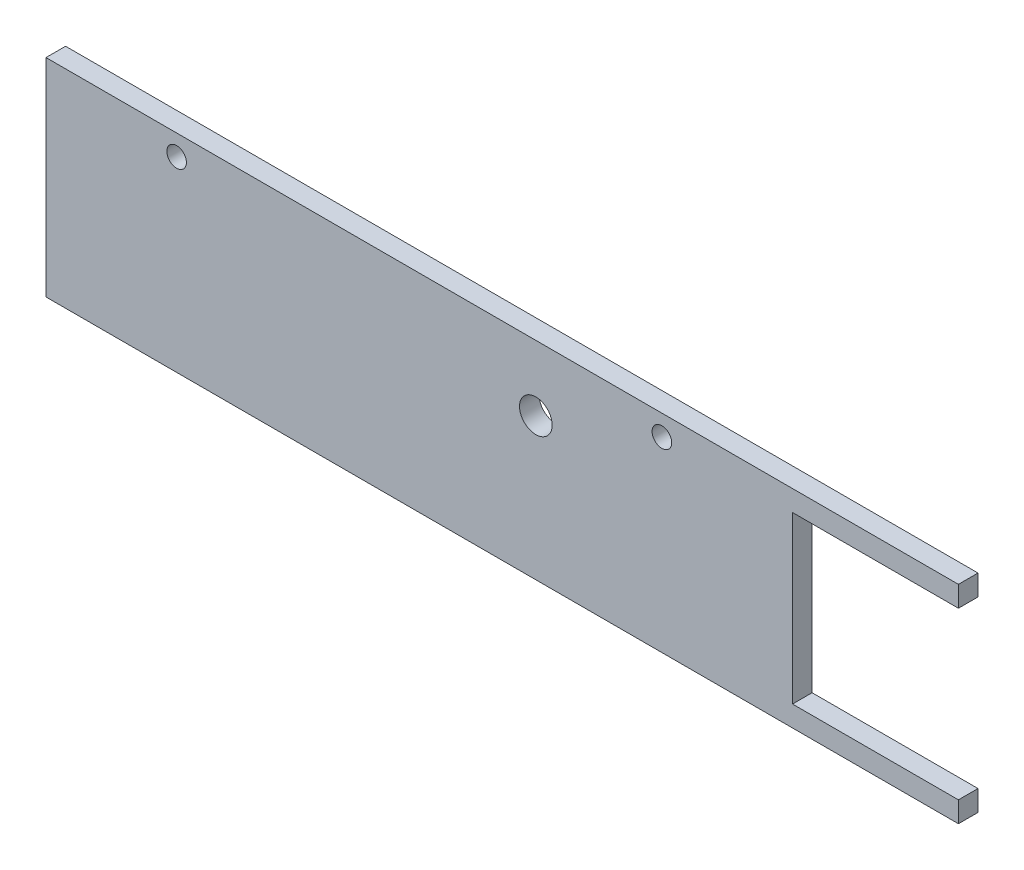
from build123d import *

# Parameters (mm, degrees)
SKETCH2_W                 = 139.7
SKETCH2_H                 = 31.75
BOSS_EXTRUDE1_DEPTH       = 3
SKETCH3_W                 = 25.4
SKETCH3_H                 = 25.4
CUT_EXTRUDE1_DEPTH        = 144.293937415
CUT_EXTRUDE4_DEPTH        = 144.293937415
CUT_EXTRUDE4_DEPTH_BACK   = 6.35
SKETCH9_R                 = 1.5
CUT_EXTRUDE5_DEPTH        = 144.293937415
CUT_EXTRUDE5_DEPTH_BACK   = 144.293937415
SKETCH8_R                 = 2.5
F_3_0MM_DOWEL_HOLE2_D     = 3
F_3_0MM_DOWEL_HOLE2_DEPTH = 6.35
F_3_0MM_DOWEL_HOLE2_TIP   = 0.901290929


with BuildPart() as part:
    # Sketch2 → Boss-Extrude1 (new body)
    with BuildSketch(Plane.XY):
        with Locations((-69.85, -15.875)):
            Rectangle(SKETCH2_W, SKETCH2_H)
    extrude(amount=BOSS_EXTRUDE1_DEPTH)

    # Sketch3 → Cut-Extrude1 (cut, through all)
    with BuildSketch(Plane.XY.offset(3)):
        with Locations((-12.7, -15.875)):
            Rectangle(SKETCH3_W, SKETCH3_H)
    extrude(amount=-CUT_EXTRUDE1_DEPTH, mode=Mode.SUBTRACT)

    # Sketch9 → Cut-Extrude4 (cut, two sides: drawn at the far end of the back side and taken through both)
    with BuildSketch(Plane.XY.offset(3).offset(-CUT_EXTRUDE4_DEPTH_BACK)):
        with Locations((-119.7, -3.175)):
            Circle(SKETCH9_R)
        with Locations((-45.4, -3.175)):
            Circle(SKETCH9_R)
    extrude(amount=CUT_EXTRUDE4_DEPTH + CUT_EXTRUDE4_DEPTH_BACK, mode=Mode.SUBTRACT)

    # Sketch8 → Cut-Extrude5 (cut, two sides: drawn at the far end of the back side and taken through both)
    with BuildSketch(Plane.XY.offset(3).offset(-CUT_EXTRUDE5_DEPTH_BACK)):
        with Locations((-64.7, -10)):
            Circle(SKETCH8_R)
    extrude(amount=CUT_EXTRUDE5_DEPTH + CUT_EXTRUDE5_DEPTH_BACK, mode=Mode.SUBTRACT)

    # Ø3.0mm Dowel Hole2
    with Locations(Plane(origin=(-146.05, -31.75, 0), x_dir=(1, 0, 0), z_dir=(0, 0, 1))):
        with Locations((26.35, 28.575), (100.65, 28.575)):
            Hole(F_3_0MM_DOWEL_HOLE2_D / 2, depth=F_3_0MM_DOWEL_HOLE2_DEPTH)
            with Locations((0, 0, -(F_3_0MM_DOWEL_HOLE2_DEPTH + F_3_0MM_DOWEL_HOLE2_TIP / 2))):  # 118° drill point
                Cone(0, F_3_0MM_DOWEL_HOLE2_D / 2, F_3_0MM_DOWEL_HOLE2_TIP, mode=Mode.SUBTRACT)


solid = part.part
